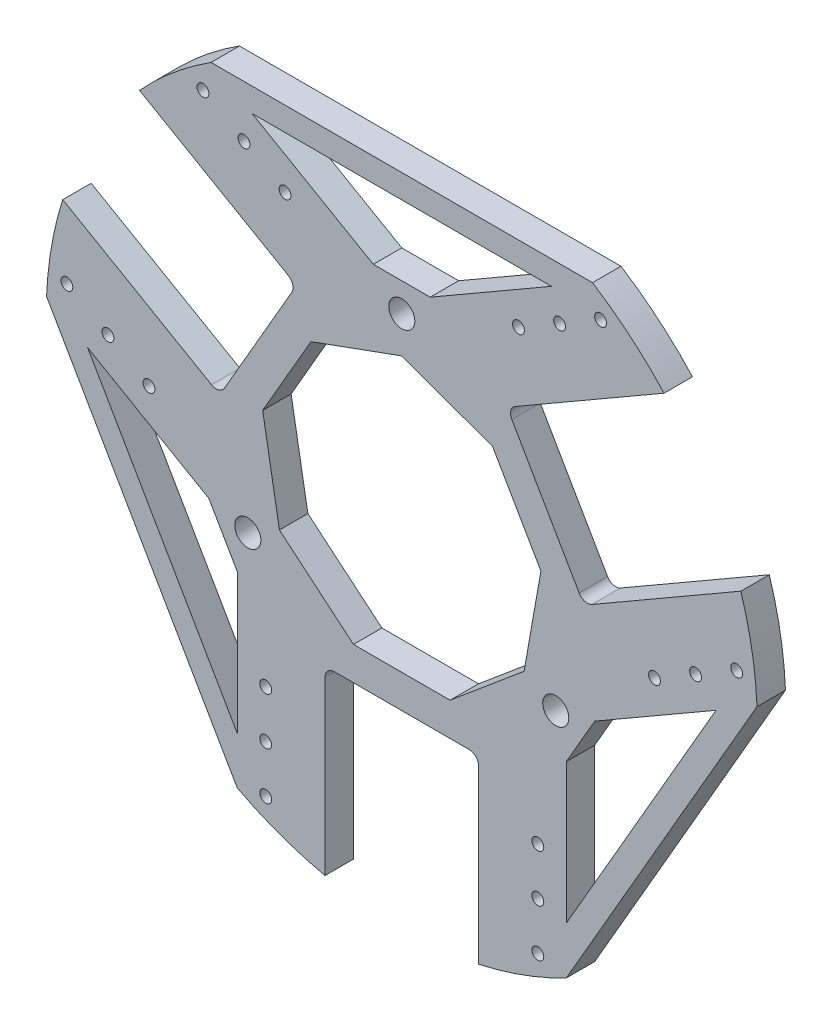
from build123d import *

# Parameters (mm, degrees)
SKETCH_1_R          = 75
SKETCH_1_R_2        = 1.25
EXTRUDE_1_DEPTH     = 6
CUT_EXTRUDE_START   = -10
CUT_EXTRUDE_2_DEPTH = 10
CUT_EXTRUDE_3_DEPTH = 10
EXTRUDE_2_DEPTH     = 6
CUT_EXTRUDE_4_DEPTH = 6
SKETCH_8_R          = 2.75
CUT_EXTRUDE_5_DEPTH = 10


with BuildPart() as part:
    # 草图1 → 凸台-拉伸1 (new body)
    with BuildSketch(Plane.XY):
        Circle(SKETCH_1_R)
        with Locations((28.7, -65)):
            Circle(SKETCH_1_R_2, mode=Mode.SUBTRACT)
        with Locations((28.7, -55)):
            Circle(SKETCH_1_R_2, mode=Mode.SUBTRACT)
        with Locations((28.7, -45)):
            Circle(SKETCH_1_R_2, mode=Mode.SUBTRACT)
        with Locations((-28.7, -45)):
            Circle(SKETCH_1_R_2, mode=Mode.SUBTRACT)
        with Locations((-28.7, -55)):
            Circle(SKETCH_1_R_2, mode=Mode.SUBTRACT)
        with Locations((-28.7, -65)):
            Circle(SKETCH_1_R_2, mode=Mode.SUBTRACT)
        with Locations((-24.62114317, 47.354929089)):
            Circle(SKETCH_1_R_2, mode=Mode.SUBTRACT)
        with Locations((-33.281397208, 52.354929089)):
            Circle(SKETCH_1_R_2, mode=Mode.SUBTRACT)
        with Locations((-41.941651246, 57.354929089)):
            Circle(SKETCH_1_R_2, mode=Mode.SUBTRACT)
        with Locations((-53.32114317, -2.354929089)):
            Circle(SKETCH_1_R_2, mode=Mode.SUBTRACT)
        with Locations((-61.981397208, 2.645070911)):
            Circle(SKETCH_1_R_2, mode=Mode.SUBTRACT)
        with Locations((-70.641651246, 7.645070911)):
            Circle(SKETCH_1_R_2, mode=Mode.SUBTRACT)
        with Locations((53.32114317, -2.354929089)):
            Circle(SKETCH_1_R_2, mode=Mode.SUBTRACT)
        with Locations((61.981397208, 2.645070911)):
            Circle(SKETCH_1_R_2, mode=Mode.SUBTRACT)
        with Locations((70.641651246, 7.645070911)):
            Circle(SKETCH_1_R_2, mode=Mode.SUBTRACT)
        with Locations((24.62114317, 47.354929089)):
            Circle(SKETCH_1_R_2, mode=Mode.SUBTRACT)
        with Locations((33.281397208, 52.354929089)):
            Circle(SKETCH_1_R_2, mode=Mode.SUBTRACT)
        with Locations((41.941651246, 57.354929089)):
            Circle(SKETCH_1_R_2, mode=Mode.SUBTRACT)
    extrude(amount=EXTRUDE_1_DEPTH)

    # 草图3 → 切除-拉伸2 (cut)
    with BuildSketch(Plane.XY.offset(6).offset(CUT_EXTRUDE_START)):
        with BuildLine():
            Line((16.2, -37), (16.2, -73.229502251))
            ThreePointArc((16.2, -73.229502251), (0, -75), (-16.2, -73.229502251))
            Line((-16.2, -73.229502251), (-16.2, -37))
            ThreePointArc((-16.2, -37), (-15.614213562, -35.585786438), (-14.2, -35))
            Line((-14.2, -35), (14.2, -35))
            ThreePointArc((14.2, -35), (15.614213562, -35.585786438), (16.2, -37))
        make_face()
        with BuildLine():
            Line((-23.94293994, 32.529611541), (-55.318609256, 50.644362667))
            ThreePointArc((-55.318609256, 50.644362667), (-64.951905284, 37.5), (-71.518609256, 22.585139584))
            Line((-71.518609256, 22.585139584), (-40.14293994, 4.470388459))
            ThreePointArc((-40.14293994, 4.470388459), (-38.62530185, 4.270587614), (-37.410889132, 5.202439266))
            Line((-37.410889132, 5.202439266), (-23.210889132, 29.797560734))
            ThreePointArc((-23.210889132, 29.797560734), (-23.011088287, 31.315198824), (-23.94293994, 32.529611541))
        make_face()
        with BuildLine():
            Line((40.14293994, 4.470388459), (71.518609256, 22.585139584))
            ThreePointArc((71.518609256, 22.585139584), (64.951905284, 37.5), (55.318609256, 50.644362667))
            Line((55.318609256, 50.644362667), (23.94293994, 32.529611541))
            ThreePointArc((23.94293994, 32.529611541), (23.011088287, 31.315198824), (23.210889132, 29.797560734))
            Line((23.210889132, 29.797560734), (37.410889132, 5.202439266))
            ThreePointArc((37.410889132, 5.202439266), (38.62530185, 4.270587614), (40.14293994, 4.470388459))
        make_face()
    extrude(amount=CUT_EXTRUDE_2_DEPTH, mode=Mode.SUBTRACT)

    # 草图5 → 切除-拉伸3 (cut)
    with BuildSketch(Plane.XY.offset(6).offset(CUT_EXTRUDE_START)):
        with BuildLine():
            Line((-40.231963322, 63.296043536), (-6, 43.532210297))
            Line((-6, 43.532210297), (6, 43.532210297))
            Line((6, 43.532210297), (40.231963322, 63.296043536))
            ThreePointArc((40.231963322, 63.296043536), (0, 75), (-40.231963322, 63.296043536))
        make_face()
        with BuildLine():
            Line((74.931963322, 3.193880513), (40.7, -16.569952726))
            Line((40.7, -16.569952726), (34.7, -26.962257571))
            Line((34.7, -26.962257571), (34.7, -66.489924049))
            ThreePointArc((34.7, -66.489924049), (64.951905284, -37.5), (74.931963322, 3.193880513))
        make_face()
        with BuildLine():
            Line((-34.7, -66.489924049), (-34.7, -26.962257571))
            Line((-34.7, -26.962257571), (-40.7, -16.569952726))
            Line((-40.7, -16.569952726), (-74.931963322, 3.193880513))
            ThreePointArc((-74.931963322, 3.193880513), (-64.951905284, -37.5), (-34.7, -66.489924049))
        make_face()
    extrude(amount=CUT_EXTRUDE_3_DEPTH, mode=Mode.SUBTRACT)

    # 草图6 → 凸台-拉伸2 (add)
    with BuildSketch(Plane.XY.offset(6)):
        Polygon((-74.931963322, 3.193880513), (-34.7, -66.489924049), (-34.7, -56.489924049), (-66.271709284, -1.806119487), align=None)
        Polygon((31.571709284, 58.296043536), (40.231963322, 63.296043536), (-40.231963322, 63.296043536), (-31.571709284, 58.296043536), align=None)
        Polygon((34.7, -56.489924049), (34.7, -66.489924049), (74.931963322, 3.193880513), (66.271709284, -1.806119487), align=None)
    extrude(amount=-EXTRUDE_2_DEPTH)

    # 草图7 → 切除-拉伸4 (cut)
    with BuildSketch(Plane.XY.offset(6)):
        Polygon((-25.804939583, -14.898488815), (-10.191166559, -28), (10.191166559, -28), (25.804939583, -14.898488815), (29.344294586, 5.174190865), (19.153128026, 22.825809135), (0, 29.796977629), (-19.153128026, 22.825809135), (-29.344294586, 5.174190865), align=None)
    extrude(amount=-CUT_EXTRUDE_4_DEPTH, mode=Mode.SUBTRACT)

    # 草图8 → 切除-拉伸5 (cut)
    with BuildSketch(Plane.XY.offset(6)):
        with Locations((0, 37.5)):
            Circle(SKETCH_8_R)
        with Locations((32.475952642, -18.75)):
            Circle(SKETCH_8_R)
        with Locations((-32.475952642, -18.75)):
            Circle(SKETCH_8_R)
    extrude(amount=-CUT_EXTRUDE_5_DEPTH, mode=Mode.SUBTRACT)


solid = part.part
